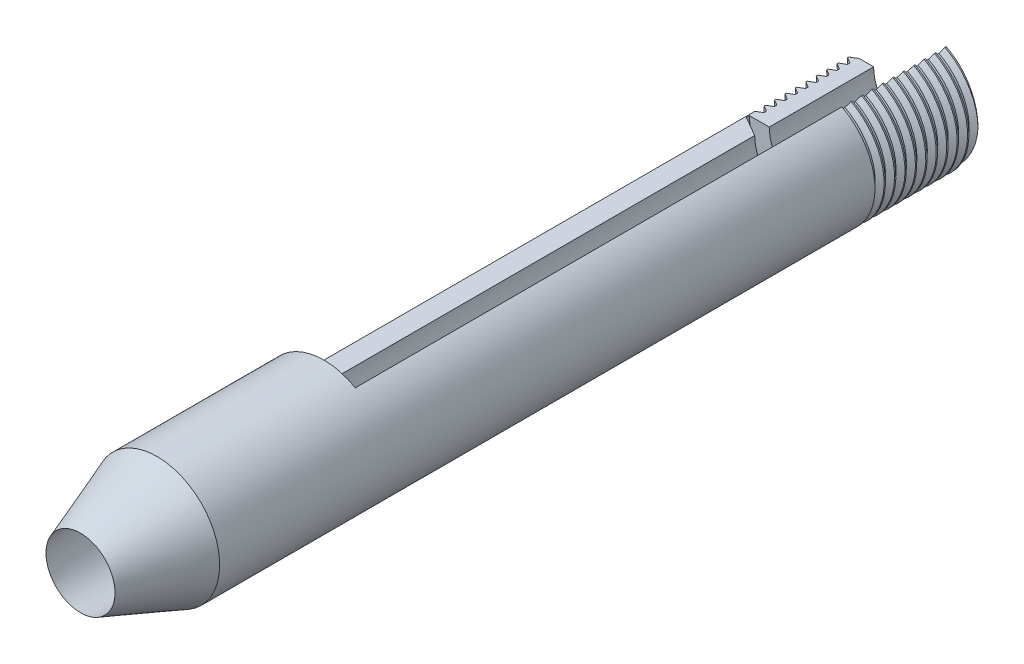
from build123d import *
from build123d.topology import SkipClean

# Parameters (mm, degrees)
REVOLVE3_ANGLE      = 240
CUT_REVOLVE19_ANGLE = 60
THREAD1_PITCH       = 1.5


with BuildPart() as part:
    # Sketch2 → Revolve2 (revolve)
    with BuildSketch(Plane(origin=(0, 0, 0), x_dir=(1, 0, 0), z_dir=(0, 1, 0))):
        Polygon((-8.85, -85), (-9, -85), (-9, -108.995476167), (-4.958031021, -119.995476167), (-6, -108.995476167), (-6, -86.9260223), (-8.85, -85.280574032), align=None)
    revolve(axis=Axis((0, 0, -52.748044522), (0, 0, 1)))

    # Sketch2<8> → Revolve3 (revolve)
    with BuildSketch(Plane(origin=(0, 0, 0), x_dir=(1, 0, 0), z_dir=(0, 1, 0))):
        Polygon((-9, 0), (-9, -108.995476167), (-4.958031021, -119.995476167), (-6, -108.995476167), (-6, 0), align=None)
    revolve(axis=Axis((0, 0, -52.748044522), (0, 0, 1)), revolution_arc=REVOLVE3_ANGLE)

    # Sketch2<12> → Cut-Revolve19 (revolve, cut)
    with SkipClean():  # the faces are left unmerged after this step: merging them gives an invalid solid
        with BuildSketch(Plane(origin=(0, 0, 0), x_dir=(1, 0, 0), z_dir=(0, 1, 0))):
            Polygon((-6, -85), (-8.85, -85), (-8.85, -85.280574032), (-6, -86.9260223), align=None)
            Polygon((-6, -15), (-8.85, -15), (-8.85, -15.448219802), (-6, -17.093668069), align=None)
        revolve(axis=Axis((0, 0, -52.748044522), (0, 0, 1)), revolution_arc=CUT_REVOLVE19_ANGLE, mode=Mode.SUBTRACT)

    # Thread1: arcs per turn and ends read off the stored shape
    # Thread1: the profile of Thread Profile4 profile screwed along a right-hand helix through 10.333333 turns, 8 arcs to a turn; built about Z, then put on its axis
    with SkipClean():  # the faces are left unmerged after this step: merging them gives an invalid solid
        thread1_z = Axis((0, 0, 0), (0, 0, 1))
        thread1_corners = [(9.0003, 0, -0.000173205), (9.0003, 0, 1.312673201), (8.188101188, 0, 0.843749998), (8.188101188, 0, 0.468749998)]
        with BuildLine(mode=Mode.PRIVATE) as thread1_profile:
            Line(thread1_corners[0], thread1_corners[1])
            Line(thread1_corners[1], thread1_corners[2])
            Line(thread1_corners[2], thread1_corners[3])
            Line(thread1_corners[3], thread1_corners[0])
        thread1_cap = Face(thread1_profile.wire())
        thread1_turn_angles = [0, 22.5, 45, 67.5, 90, 112.5, 135, 157.5, 180, 202.5, 225, 247.5, 270, 292.5, 315, 337.5, 360]
        thread1_turn_weights = [1, 0.9238795325112867, 1, 0.9238795325112867, 1, 0.9238795325112867, 1, 0.9238795325112867, 1, 0.9238795325112867, 1, 0.9238795325112867, 1, 0.9238795325112867, 1, 0.9238795325112867, 1]
        thread1_turn_rails = [Edge.make_bspline([Vector(p[0], p[1], 0).rotate(thread1_z, thread1_turn_angles[k]) / thread1_turn_weights[k] + Vector(0, 0, p[2] + THREAD1_PITCH * thread1_turn_angles[k] / 360) for k in range(17)], [0, 0, 0, 1, 1, 2, 2, 3, 3, 4, 4, 5, 5, 6, 6, 7, 7, 8, 8, 8], 2, thread1_turn_weights) for p in thread1_corners]
        thread1_turn_sides = [Face.make_surface_from_curves(thread1_turn_rails[p[0]], thread1_turn_rails[p[1]]) for p in [(0, 1), (1, 2), (2, 3), (3, 0)]]
        thread1_last_angles = [3600, 3622.5, 3645, 3667.5, 3690, 3705, 3720]
        thread1_last_weights = [1, 0.9238795325112867, 1, 0.9238795325112867, 1, 0.9659258262890683, 1]
        thread1_last_rails = [Edge.make_bspline([Vector(p[0], p[1], 0).rotate(thread1_z, thread1_last_angles[k]) / thread1_last_weights[k] + Vector(0, 0, p[2] + THREAD1_PITCH * thread1_last_angles[k] / 360) for k in range(7)], [0, 0, 0, 1, 1, 2, 2, 3, 3, 3], 2, thread1_last_weights) for p in thread1_corners]
        thread1_last_sides = [Face.make_surface_from_curves(thread1_last_rails[p[0]], thread1_last_rails[p[1]]) for p in [(0, 1), (1, 2), (2, 3), (3, 0)]]
        thread1 = Plane(origin=(0, 0, -1.5), x_dir=(1, 0, 0), z_dir=(0, 0, 1)) * Solid(Shell([*[p.moved(Location((0, 0, THREAD1_PITCH * i))) for i in range(10) for p in thread1_turn_sides], *thread1_last_sides, thread1_cap, thread1_cap.rotate(thread1_z, 3720).moved(Location((0, 0, THREAD1_PITCH * 3720 / 360)))]))
        add(thread1, mode=Mode.SUBTRACT)


solid = part.part
